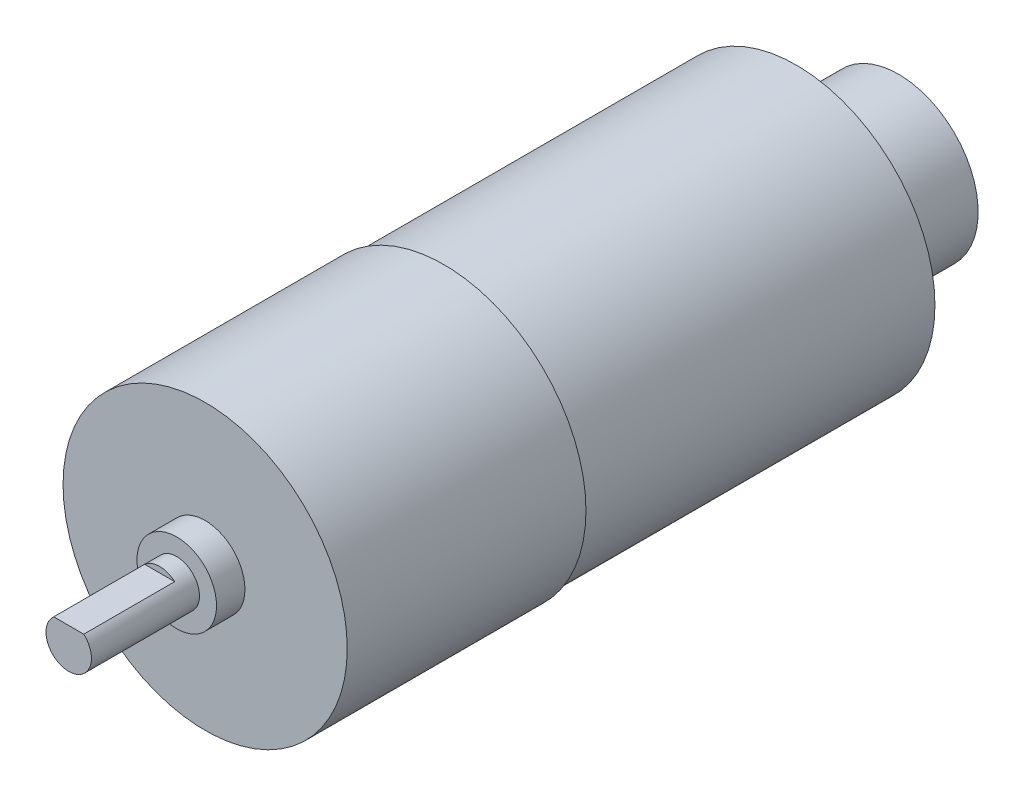
from build123d import *

# Parameters (mm, degrees)
SKETCH1_R           = 12.2
BOSS_EXTRUDE1_DEPTH = 31
SKETCH2_R           = 12.5
BOSS_EXTRUDE2_DEPTH = 21
SKETCH3_R           = 3.5
BOSS_EXTRUDE3_DEPTH = 2.5
SKETCH4_R           = 2
BOSS_EXTRUDE5_DEPTH = 1.5
BOSS_EXTRUDE6_DEPTH = 8
SKETCH6_R           = 0.5
BOSS_EXTRUDE7_DEPTH = 1
SKETCH7_R           = 7
BOSS_EXTRUDE8_DEPTH = 8


with BuildPart() as part:
    # Sketch1 → Boss-Extrude1 (new body)
    with BuildSketch(Plane.XY):
        Circle(SKETCH1_R)
    extrude(amount=BOSS_EXTRUDE1_DEPTH)

    # Sketch2 → Boss-Extrude2 (add)
    with BuildSketch(Plane.XY.offset(31)):
        Circle(SKETCH2_R)
    extrude(amount=BOSS_EXTRUDE2_DEPTH)

    # Sketch3 → Boss-Extrude3 (add)
    with BuildSketch(Plane.XY.offset(52)):
        Circle(SKETCH3_R)
    extrude(amount=BOSS_EXTRUDE3_DEPTH)

    # Sketch4 → Boss-Extrude5 (add)
    with BuildSketch(Plane.XY.offset(54.5)):
        Circle(SKETCH4_R)
    extrude(amount=BOSS_EXTRUDE5_DEPTH)

    # Sketch5 → Boss-Extrude6 (add)
    with BuildSketch(Plane.XY.offset(56)):
        with BuildLine():
            Line((0, 1.5), (1.322875656, 1.5))
            ThreePointArc((1.322875656, 1.5), (0, -2), (-1.322875656, 1.5))
            Line((-1.322875656, 1.5), (0, 1.5))
        make_face()
    extrude(amount=BOSS_EXTRUDE6_DEPTH)

    # Sketch6 → Boss-Extrude7 (add)
    with BuildSketch(Plane(origin=(0, 0, 0), x_dir=(-1, 0, 0), z_dir=(0, 0, -1))):
        Circle(SKETCH6_R)
    extrude(amount=BOSS_EXTRUDE7_DEPTH)

    # Sketch7 → Boss-Extrude8 (add)
    with BuildSketch(Plane(origin=(0, 0, -1), x_dir=(-1, 0, 0), z_dir=(0, 0, -1))):
        Circle(SKETCH7_R)
    extrude(amount=BOSS_EXTRUDE8_DEPTH)


solid = part.part
